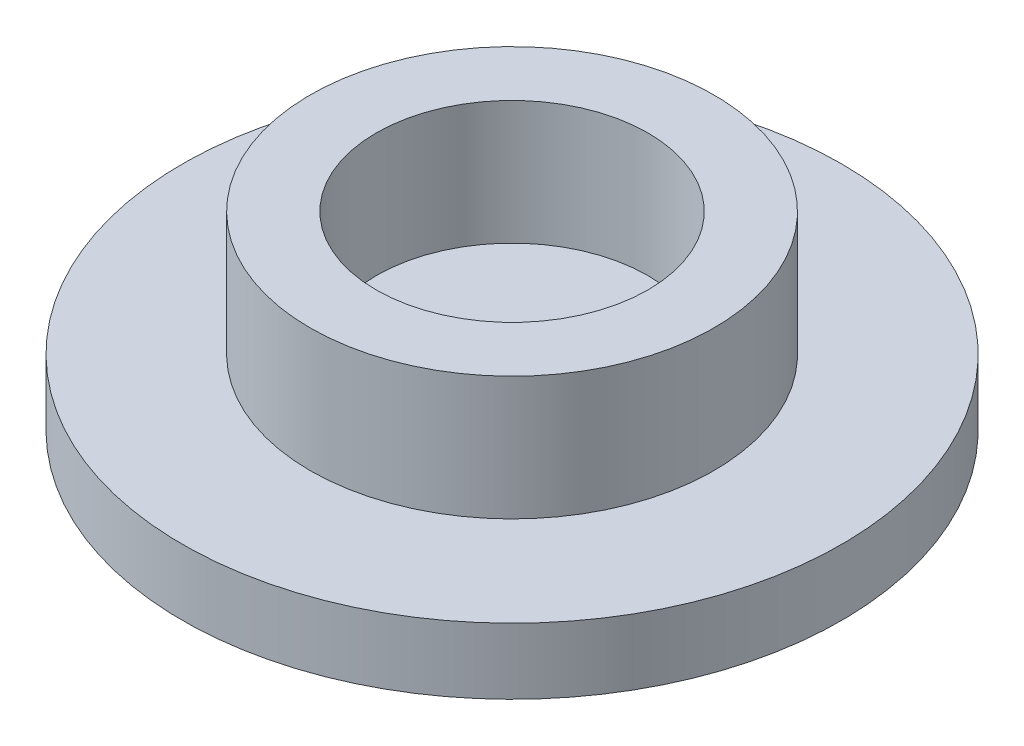
from build123d import *

# Parameters (mm, degrees)
SKETCH1_R           = 2.45
SKETCH1_R_2         = 1.65
BOSS_EXTRUDE1_DEPTH = 1.5
SKETCH2_R           = 4
BOSS_EXTRUDE2_DEPTH = 0.8


with BuildPart() as part:
    # Sketch1 → Boss-Extrude1 (new body)
    with BuildSketch(Plane(origin=(0, 0, 0), x_dir=(1, 0, 0), z_dir=(0, 1, 0))):
        Circle(SKETCH1_R)
        Circle(SKETCH1_R_2, mode=Mode.SUBTRACT)
    extrude(amount=BOSS_EXTRUDE1_DEPTH)

    # Sketch2 → Boss-Extrude2 (add)
    with BuildSketch(Plane.XZ):
        Circle(SKETCH2_R)
    extrude(amount=BOSS_EXTRUDE2_DEPTH)


solid = part.part
